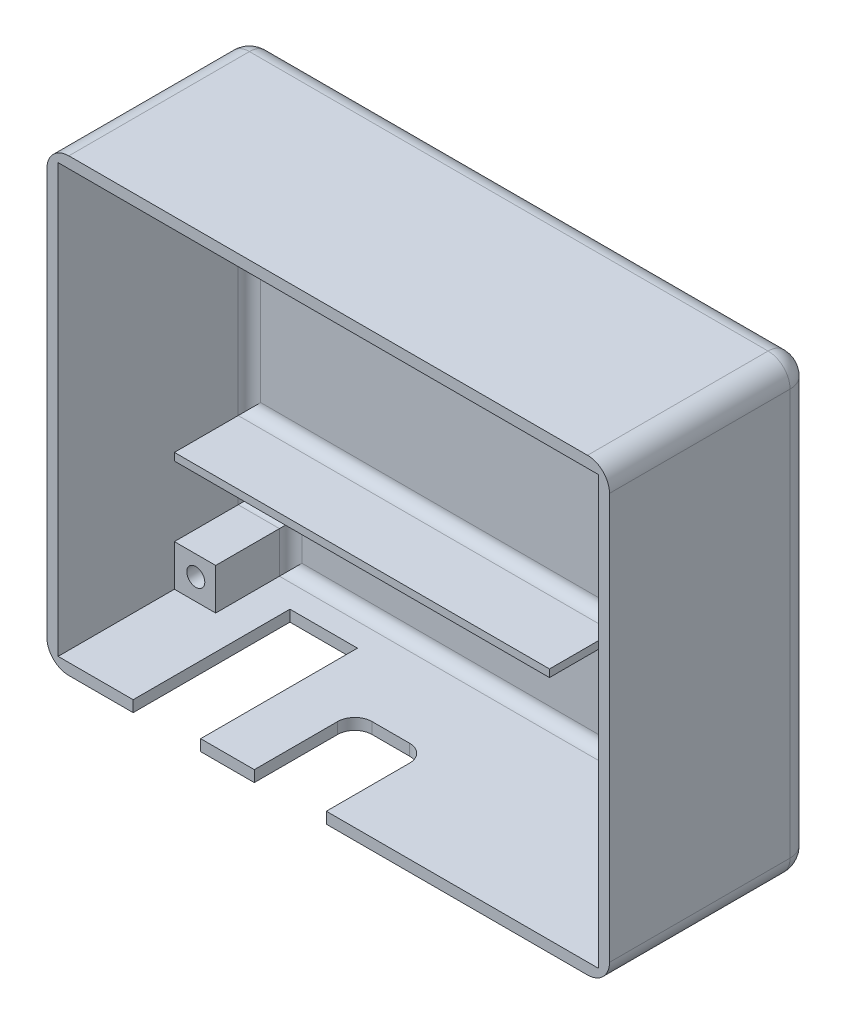
from build123d import *

# Parameters (mm, degrees)
SKETCH2_W               = 75
SKETCH2_H               = 60
BODY_CREATION_DEPTH     = 27
THIKNESS_OF_WALLS_T     = -1.5
SKETCH6_W               = 5.5
SKETCH6_H               = 5.5
CORNER_RECT_DEPTH       = 10
SKETCH8_R               = 1.2
SCREW_HOLE_DEPTH        = 27
SKETCH10_R              = 2
SCREW_HEAD_DEPTH        = 4
SKETCH5_W               = 9
SKETCH5_H               = 20.9
PORTS_CUT_OUT_DEPTH     = 1.5
SKETCH11_W              = 44.5
SKETCH11_H              = 1
SKETCH11_W_2            = 50
SKETCH11_W_3            = 1.25
SKETCH11_H_2            = 22.5
BATTERY_PLACEMENT_DEPTH = 10
FILLET1_R               = 1.5
FILLET2_R               = 2.93
SKETCH13_W              = 50
SKETCH13_H              = 40
CUT_EXTRUDE1_DEPTH      = 1


with BuildPart() as part:
    # Sketch2 → Body creation (new body)
    with BuildSketch(Plane.XY):
        with Locations((37.5, 30)):
            Rectangle(SKETCH2_W, SKETCH2_H)
    extrude(amount=BODY_CREATION_DEPTH)

    # Thikness of walls
    thikness_of_walls_openings = [part.faces().sort_by_distance(p)[0] for p in [
        (37.5, 30, 27),
    ]]
    offset(amount=THIKNESS_OF_WALLS_T, openings=thikness_of_walls_openings, kind=Kind.INTERSECTION)

    # Sketch6 → Corner rect. (add)
    with BuildSketch(Plane.XY.offset(1.5)):
        with Locations((4.25, 55.75)):
            Rectangle(SKETCH6_W, SKETCH6_H)
        with Locations((70.75, 55.75)):
            Rectangle(SKETCH6_W, SKETCH6_H)
    corner_rect = extrude(amount=CORNER_RECT_DEPTH)

    # Sketch8 → Screw hole (cut)
    with BuildSketch(Plane.XY.offset(27)):
        with Locations((4.35, 55.65)):
            Circle(SKETCH8_R)
        with Locations(Location((70.65, 55.65, 0), (0, 0, 180))):
            Circle(SKETCH8_R)
    screw_hole = extrude(amount=-SCREW_HOLE_DEPTH, mode=Mode.SUBTRACT)

    # Sketch10 → Screw head (cut)
    with BuildSketch(Plane(origin=(0, 0, 0), x_dir=(-1, 0, 0), z_dir=(0, 0, -1))):
        with Locations((-70.65, 55.65)):
            Circle(SKETCH10_R)
        with Locations((-4.35, 55.65)):
            Circle(SKETCH10_R)
    screw_head = extrude(amount=-SCREW_HEAD_DEPTH, mode=Mode.SUBTRACT)

    # Mirror to other side: Corner rect., Screw hole, Screw head across plane
    add(corner_rect.mirror(Plane(origin=(0, 30, 0), x_dir=(0, 0, 1), z_dir=(0, -1, 0))))
    add(screw_hole.mirror(Plane(origin=(0, 30, 0), x_dir=(0, 0, 1), z_dir=(0, -1, 0))), mode=Mode.SUBTRACT)
    add(screw_head.mirror(Plane(origin=(0, 30, 0), x_dir=(0, 0, 1), z_dir=(0, -1, 0))), mode=Mode.SUBTRACT)

    # Sketch5 → Ports cut out (cut)
    with BuildSketch(Plane.XZ):
        with Locations((16, 16.55)):
            Rectangle(SKETCH5_W, SKETCH5_H)
        with BuildLine():
            Line((29.95, 13.6), (34.95, 13.6))
            ThreePointArc((34.95, 13.6), (36.576345597, 14.273654403), (37.25, 15.9))
            Line((37.25, 15.9), (37.25, 27))
            Line((37.25, 27), (27.65, 27))
            Line((27.65, 27), (27.65, 15.9))
            ThreePointArc((27.65, 15.9), (28.323654403, 14.273654403), (29.95, 13.6))
        make_face()
    extrude(amount=-PORTS_CUT_OUT_DEPTH, mode=Mode.SUBTRACT)

    # Sketch11 → Battery Placement (add)
    with BuildSketch(Plane.XY.offset(1.5)):
        with Locations((29.25, 53.5)):
            Rectangle(SKETCH11_W, SKETCH11_H)
        with Locations((26.5, 16.8)):
            Rectangle(SKETCH11_W_2, SKETCH11_H)
        with Locations((67.375, 47.25)):
            Rectangle(SKETCH11_W_3, SKETCH11_H_2)
    extrude(amount=BATTERY_PLACEMENT_DEPTH)

    # Fillet1
    fillet1_edges = [part.edges().sort_by_distance(p)[0] for p in [
        (7, 56.25, 1.5),
        (51.5, 53.5, 1.5),
        (29.25, 54, 1.5),
        (1.5, 11.65, 1.5),
        (51.5, 16.8, 1.5),
        (26.5, 17.3, 1.5),
        (26.5, 16.3, 1.5),
        (36.875, 58.5, 1.5),
        (68, 44.5, 1.5),
        (66.75, 47.25, 1.5),
        (67.375, 36, 1.5),
        (1.5, 35.15, 1.5),
        (26.5, 53, 1.5),
        (70.75, 53, 1.5),
        (37.5, 1.5, 1.5),
        (4.25, 7, 1.5),
        (7, 4.25, 1.5),
        (73.5, 30, 1.5),
        (68, 4.25, 1.5),
        (70.75, 7, 1.5),
    ]]
    fillet(fillet1_edges, radius=FILLET1_R)

    # Fillet2
    # the kernel refuses this fillet: 2.93 mm, written as the material it takes off along each edge
    with BuildSketch(Plane(origin=(72.07, 57.07, 2.93), x_dir=(1, 0, 0), z_dir=(0, 1, 0))) as fillet2_piece_1_section:
        Polygon((0, 0), (FILLET2_R, 0), (FILLET2_R, FILLET2_R), (0, FILLET2_R), align=None)
    fillet2_piece_1 = extrude(amount=FILLET2_R, mode=Mode.PRIVATE)
    fillet2_piece_1 = fillet2_piece_1 - Plane(origin=(72.07, 57.07, 2.93), x_dir=(-0.7071067811865475, 0, 0.7071067811865475), z_dir=(0, 1, 0)) * Sphere(FILLET2_R, mode=Mode.PRIVATE)
    add(fillet2_piece_1, mode=Mode.SUBTRACT)
    with BuildSketch(Plane(origin=(2.93, 57.07, 2.93), x_dir=(0, 1, 0), z_dir=(-1, 0, 0))) as fillet2_piece_2_section:
        Polygon((0, 0), (FILLET2_R, 0), (FILLET2_R, FILLET2_R), (0, FILLET2_R), align=None)
    fillet2_piece_2 = extrude(amount=FILLET2_R, mode=Mode.PRIVATE)
    fillet2_piece_2 = fillet2_piece_2 - Plane(origin=(2.93, 57.07, 2.93), x_dir=(0, -0.7071067811865475, 0.7071067811865475), z_dir=(-1, 0, 0)) * Sphere(FILLET2_R, mode=Mode.PRIVATE)
    add(fillet2_piece_2, mode=Mode.SUBTRACT)
    with BuildSketch(Plane(origin=(72.07, 2.93, 2.93), x_dir=(0, -1, 0), z_dir=(1, 0, 0))) as fillet2_piece_3_section:
        Polygon((0, 0), (FILLET2_R, 0), (FILLET2_R, FILLET2_R), (0, FILLET2_R), align=None)
    fillet2_piece_3 = extrude(amount=FILLET2_R, mode=Mode.PRIVATE)
    fillet2_piece_3 = fillet2_piece_3 - Plane(origin=(72.07, 2.93, 2.93), x_dir=(0, 0.7071067811865475, 0.7071067811865475), z_dir=(1, 0, 0)) * Sphere(FILLET2_R, mode=Mode.PRIVATE)
    add(fillet2_piece_3, mode=Mode.SUBTRACT)
    with BuildSketch(Plane(origin=(2.93, 2.93, 2.93), x_dir=(0, -1, 0), z_dir=(-1, 0, 0))) as fillet2_piece_4_section:
        Polygon((0, 0), (FILLET2_R, 0), (FILLET2_R, -FILLET2_R), (0, -FILLET2_R), align=None)
    fillet2_piece_4 = extrude(amount=FILLET2_R, mode=Mode.PRIVATE)
    fillet2_piece_4 = fillet2_piece_4 - Plane(origin=(2.93, 2.93, 2.93), x_dir=(0, 0.7071067811865475, 0.7071067811865475), z_dir=(-1, 0, 0)) * Sphere(FILLET2_R, mode=Mode.PRIVATE)
    add(fillet2_piece_4, mode=Mode.SUBTRACT)
    with BuildSketch(Plane(origin=(72.07, 60, 0), x_dir=(0, 0, 1), z_dir=(-1, 0, 0)), Plane(origin=(2.93, 0, 0), x_dir=(0, 0, 1), z_dir=(1, 0, 0))) as fillet2_piece_5:
        with BuildLine():
            CenterArc((FILLET2_R, -FILLET2_R), FILLET2_R, 90, 90)
            Line((0, -FILLET2_R), (0, 0))
            Line((0, 0), (FILLET2_R, 0))
        make_face()
    extrude(amount=69.14, mode=Mode.SUBTRACT)
    with BuildSketch(Plane(origin=(75, 2.93, 0), x_dir=(0, 0, 1), z_dir=(0, 1, 0)), Plane(origin=(0, 57.07, 0), x_dir=(0, 0, 1), z_dir=(0, -1, 0))) as fillet2_piece_6:
        with BuildLine():
            CenterArc((FILLET2_R, -FILLET2_R), FILLET2_R, 90, 90)
            Line((0, -FILLET2_R), (0, 0))
            Line((0, 0), (FILLET2_R, 0))
        make_face()
    extrude(amount=54.14, mode=Mode.SUBTRACT)
    with BuildSketch(Plane(origin=(0, 60, 2.93), x_dir=(0, -1, 0), z_dir=(0, 0, 1)), Plane(origin=(75, 60, 2.93), x_dir=(-1, 0, 0), z_dir=(0, 0, 1)), Plane(origin=(75, 0, 2.93), x_dir=(0, 1, 0), z_dir=(0, 0, 1))) as fillet2_piece_7:
        with BuildLine():
            CenterArc((FILLET2_R, FILLET2_R), FILLET2_R, 180, 90)
            Line((0, FILLET2_R), (0, 0))
            Line((0, 0), (FILLET2_R, 0))
        make_face()
    extrude(amount=31.395, mode=Mode.SUBTRACT)
    with BuildSketch(Plane(origin=(0, 0, 2.93), x_dir=(0, 1, 0), z_dir=(0, 0, 1))) as fillet2_piece_8:
        with BuildLine():
            CenterArc((FILLET2_R, -FILLET2_R), FILLET2_R, 90, 90)
            Line((0, -FILLET2_R), (0, 0))
            Line((0, 0), (FILLET2_R, 0))
        make_face()
    extrude(amount=31.395, mode=Mode.SUBTRACT)

    # Sketch13 → Cut-Extrude1 (cut)
    with BuildSketch(Plane(origin=(0, 0, 0), x_dir=(-1, 0, 0), z_dir=(0, 0, -1))):
        with Locations((-37.5, 30)):
            Rectangle(SKETCH13_W, SKETCH13_H)
    extrude(amount=-CUT_EXTRUDE1_DEPTH, mode=Mode.SUBTRACT)


solid = part.part
